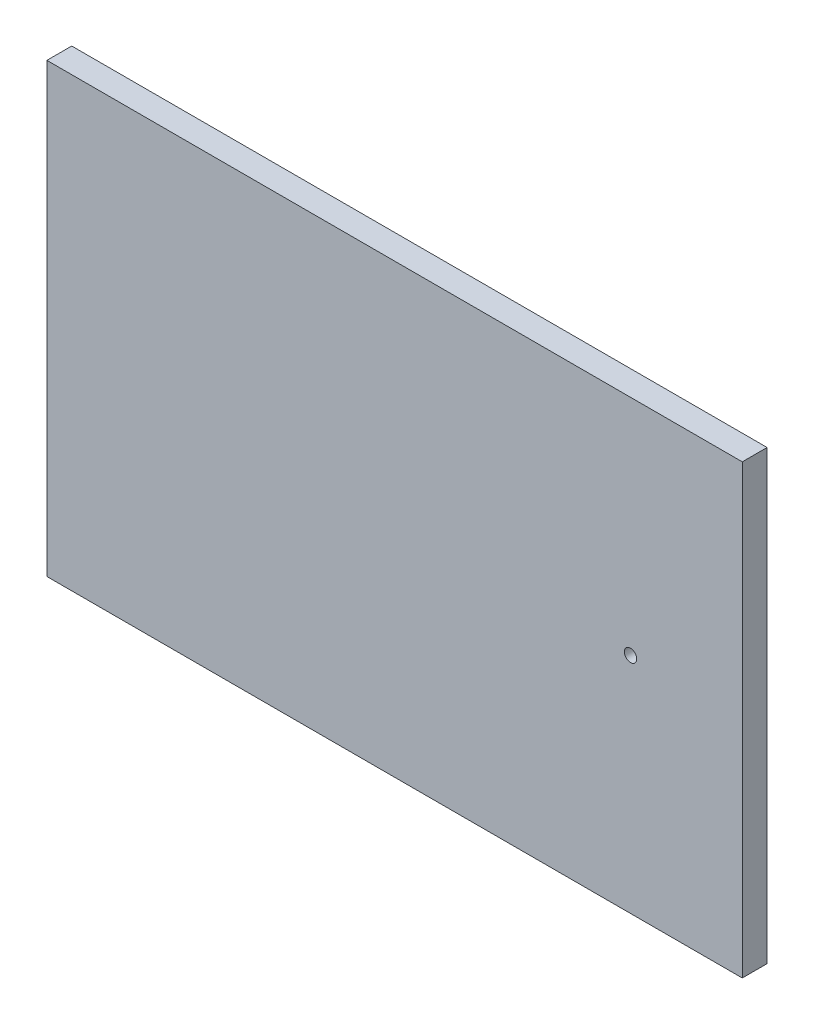
from build123d import *

# Parameters (mm, degrees)
SKETCH2_W           = 355.6
SKETCH2_H           = 228.6
BOSS_EXTRUDE1_DEPTH = 12.7
SKETCH3_R           = 3.175
CUT_EXTRUDE1_DEPTH  = 12.7


with BuildPart() as part:
    # Sketch2 → Boss-Extrude1 (new body)
    with BuildSketch(Plane.XY):
        with Locations((177.8, -114.3)):
            Rectangle(SKETCH2_W, SKETCH2_H)
    extrude(amount=BOSS_EXTRUDE1_DEPTH)

    # Sketch3 → Cut-Extrude1 (cut)
    with BuildSketch(Plane.XY.offset(12.7)):
        with Locations((298.45, -114.3)):
            Circle(SKETCH3_R)
    extrude(amount=-CUT_EXTRUDE1_DEPTH, mode=Mode.SUBTRACT)


solid = part.part
